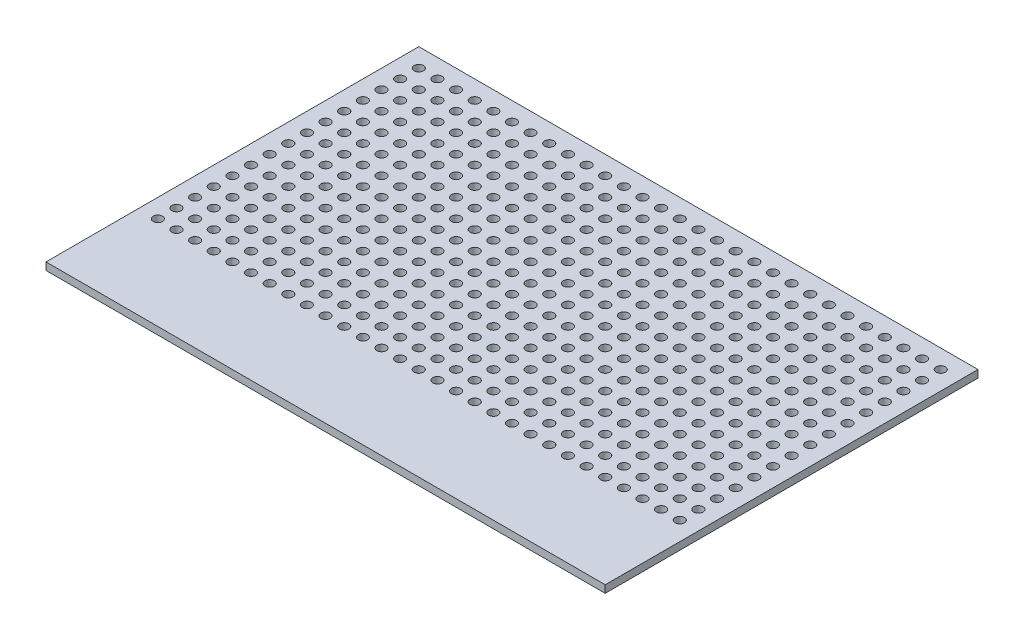
from build123d import *

# Parameters (mm, degrees)
SKETCH1_W           = 600
SKETCH1_H           = 400
BOSS_EXTRUDE1_DEPTH = 8
SKETCH2_R           = 5
CUT_EXTRUDE1_DEPTH  = 8
LPATTERN1_OUTLINE_R = 5
LPATTERN1_DEPTH     = 8


# Read off the part's stored shape, not the designer's step: LPattern1
with BuildPart() as part:
    # Sketch1 → Boss-Extrude1 (new body)
    with BuildSketch(Plane(origin=(0, 0, 0), x_dir=(1, 0, 0), z_dir=(0, 1, 0))):
        Rectangle(SKETCH1_W, SKETCH1_H)
    extrude(amount=BOSS_EXTRUDE1_DEPTH)

    # Sketch2 → Cut-Extrude1 (cut)
    with BuildSketch(Plane(origin=(0, 8, 0), x_dir=(1, 0, 0), z_dir=(0, 1, 0))):
        with Locations(Location((-280, 180, 0), (0, 0, 270))):
            Circle(SKETCH2_R)
    extrude(amount=-CUT_EXTRUDE1_DEPTH, mode=Mode.SUBTRACT)

    # LPattern1 outline → LPattern1 (cut)
    with BuildSketch(Plane(origin=(0, 0, 0), x_dir=(1, 0, 0), z_dir=(0, 1, 0))):
        with Locations((280, -100)):
            Circle(LPATTERN1_OUTLINE_R)
        with Locations((260, -100)):
            Circle(LPATTERN1_OUTLINE_R)
        with Locations((240, -100)):
            Circle(LPATTERN1_OUTLINE_R)
        with Locations((220, -100)):
            Circle(LPATTERN1_OUTLINE_R)
        with Locations((200, -100)):
            Circle(LPATTERN1_OUTLINE_R)
        with Locations((180, -100)):
            Circle(LPATTERN1_OUTLINE_R)
        with Locations((160, -100)):
            Circle(LPATTERN1_OUTLINE_R)
        with Locations((140, -100)):
            Circle(LPATTERN1_OUTLINE_R)
        with Locations((120, -100)):
            Circle(LPATTERN1_OUTLINE_R)
        with Locations((100, -100)):
            Circle(LPATTERN1_OUTLINE_R)
        with Locations((80, -100)):
            Circle(LPATTERN1_OUTLINE_R)
        with Locations((60, -100)):
            Circle(LPATTERN1_OUTLINE_R)
        with Locations((40, -100)):
            Circle(LPATTERN1_OUTLINE_R)
        with Locations((20, -100)):
            Circle(LPATTERN1_OUTLINE_R)
        with Locations((0, -100)):
            Circle(LPATTERN1_OUTLINE_R)
        with Locations((-20, -100)):
            Circle(LPATTERN1_OUTLINE_R)
        with Locations((-40, -100)):
            Circle(LPATTERN1_OUTLINE_R)
        with Locations((-60, -100)):
            Circle(LPATTERN1_OUTLINE_R)
        with Locations((-80, -100)):
            Circle(LPATTERN1_OUTLINE_R)
        with Locations((-100, -100)):
            Circle(LPATTERN1_OUTLINE_R)
        with Locations((-120, -100)):
            Circle(LPATTERN1_OUTLINE_R)
        with Locations((-140, -100)):
            Circle(LPATTERN1_OUTLINE_R)
        with Locations((-160, -100)):
            Circle(LPATTERN1_OUTLINE_R)
        with Locations((-180, -100)):
            Circle(LPATTERN1_OUTLINE_R)
        with Locations((-200, -100)):
            Circle(LPATTERN1_OUTLINE_R)
        with Locations((-220, -100)):
            Circle(LPATTERN1_OUTLINE_R)
        with Locations((-240, -100)):
            Circle(LPATTERN1_OUTLINE_R)
        with Locations((-260, -100)):
            Circle(LPATTERN1_OUTLINE_R)
        with Locations((-280, -100)):
            Circle(LPATTERN1_OUTLINE_R)
        with Locations((280, -80)):
            Circle(LPATTERN1_OUTLINE_R)
        with Locations((260, -80)):
            Circle(LPATTERN1_OUTLINE_R)
        with Locations((240, -80)):
            Circle(LPATTERN1_OUTLINE_R)
        with Locations((220, -80)):
            Circle(LPATTERN1_OUTLINE_R)
        with Locations((200, -80)):
            Circle(LPATTERN1_OUTLINE_R)
        with Locations((180, -80)):
            Circle(LPATTERN1_OUTLINE_R)
        with Locations((160, -80)):
            Circle(LPATTERN1_OUTLINE_R)
        with Locations((140, -80)):
            Circle(LPATTERN1_OUTLINE_R)
        with Locations((120, -80)):
            Circle(LPATTERN1_OUTLINE_R)
        with Locations((100, -80)):
            Circle(LPATTERN1_OUTLINE_R)
        with Locations((80, -80)):
            Circle(LPATTERN1_OUTLINE_R)
        with Locations((60, -80)):
            Circle(LPATTERN1_OUTLINE_R)
        with Locations((40, -80)):
            Circle(LPATTERN1_OUTLINE_R)
        with Locations((20, -80)):
            Circle(LPATTERN1_OUTLINE_R)
        with Locations((0, -80)):
            Circle(LPATTERN1_OUTLINE_R)
        with Locations((-20, -80)):
            Circle(LPATTERN1_OUTLINE_R)
        with Locations((-40, -80)):
            Circle(LPATTERN1_OUTLINE_R)
        with Locations((-60, -80)):
            Circle(LPATTERN1_OUTLINE_R)
        with Locations((-80, -80)):
            Circle(LPATTERN1_OUTLINE_R)
        with Locations((-100, -80)):
            Circle(LPATTERN1_OUTLINE_R)
        with Locations((-120, -80)):
            Circle(LPATTERN1_OUTLINE_R)
        with Locations((-140, -80)):
            Circle(LPATTERN1_OUTLINE_R)
        with Locations((-160, -80)):
            Circle(LPATTERN1_OUTLINE_R)
        with Locations((-180, -80)):
            Circle(LPATTERN1_OUTLINE_R)
        with Locations((-200, -80)):
            Circle(LPATTERN1_OUTLINE_R)
        with Locations((-220, -80)):
            Circle(LPATTERN1_OUTLINE_R)
        with Locations((-240, -80)):
            Circle(LPATTERN1_OUTLINE_R)
        with Locations((-260, -80)):
            Circle(LPATTERN1_OUTLINE_R)
        with Locations((-280, -80)):
            Circle(LPATTERN1_OUTLINE_R)
        with Locations((280, -60)):
            Circle(LPATTERN1_OUTLINE_R)
        with Locations((260, -60)):
            Circle(LPATTERN1_OUTLINE_R)
        with Locations((240, -60)):
            Circle(LPATTERN1_OUTLINE_R)
        with Locations((220, -60)):
            Circle(LPATTERN1_OUTLINE_R)
        with Locations((200, -60)):
            Circle(LPATTERN1_OUTLINE_R)
        with Locations((180, -60)):
            Circle(LPATTERN1_OUTLINE_R)
        with Locations((160, -60)):
            Circle(LPATTERN1_OUTLINE_R)
        with Locations((140, -60)):
            Circle(LPATTERN1_OUTLINE_R)
        with Locations((120, -60)):
            Circle(LPATTERN1_OUTLINE_R)
        with Locations((100, -60)):
            Circle(LPATTERN1_OUTLINE_R)
        with Locations((80, -60)):
            Circle(LPATTERN1_OUTLINE_R)
        with Locations((60, -60)):
            Circle(LPATTERN1_OUTLINE_R)
        with Locations((40, -60)):
            Circle(LPATTERN1_OUTLINE_R)
        with Locations((20, -60)):
            Circle(LPATTERN1_OUTLINE_R)
        with Locations((0, -60)):
            Circle(LPATTERN1_OUTLINE_R)
        with Locations((-20, -60)):
            Circle(LPATTERN1_OUTLINE_R)
        with Locations((-40, -60)):
            Circle(LPATTERN1_OUTLINE_R)
        with Locations((-60, -60)):
            Circle(LPATTERN1_OUTLINE_R)
        with Locations((-80, -60)):
            Circle(LPATTERN1_OUTLINE_R)
        with Locations((-100, -60)):
            Circle(LPATTERN1_OUTLINE_R)
        with Locations((-120, -60)):
            Circle(LPATTERN1_OUTLINE_R)
        with Locations((-140, -60)):
            Circle(LPATTERN1_OUTLINE_R)
        with Locations((-160, -60)):
            Circle(LPATTERN1_OUTLINE_R)
        with Locations((-180, -60)):
            Circle(LPATTERN1_OUTLINE_R)
        with Locations((-200, -60)):
            Circle(LPATTERN1_OUTLINE_R)
        with Locations((-220, -60)):
            Circle(LPATTERN1_OUTLINE_R)
        with Locations((-240, -60)):
            Circle(LPATTERN1_OUTLINE_R)
        with Locations((-260, -60)):
            Circle(LPATTERN1_OUTLINE_R)
        with Locations((-280, -60)):
            Circle(LPATTERN1_OUTLINE_R)
        with Locations((280, -40)):
            Circle(LPATTERN1_OUTLINE_R)
        with Locations((260, -40)):
            Circle(LPATTERN1_OUTLINE_R)
        with Locations((240, -40)):
            Circle(LPATTERN1_OUTLINE_R)
        with Locations((220, -40)):
            Circle(LPATTERN1_OUTLINE_R)
        with Locations((200, -40)):
            Circle(LPATTERN1_OUTLINE_R)
        with Locations((180, -40)):
            Circle(LPATTERN1_OUTLINE_R)
        with Locations((160, -40)):
            Circle(LPATTERN1_OUTLINE_R)
        with Locations((140, -40)):
            Circle(LPATTERN1_OUTLINE_R)
        with Locations((120, -40)):
            Circle(LPATTERN1_OUTLINE_R)
        with Locations((100, -40)):
            Circle(LPATTERN1_OUTLINE_R)
        with Locations((80, -40)):
            Circle(LPATTERN1_OUTLINE_R)
        with Locations((60, -40)):
            Circle(LPATTERN1_OUTLINE_R)
        with Locations((40, -40)):
            Circle(LPATTERN1_OUTLINE_R)
        with Locations((20, -40)):
            Circle(LPATTERN1_OUTLINE_R)
        with Locations((0, -40)):
            Circle(LPATTERN1_OUTLINE_R)
        with Locations((-20, -40)):
            Circle(LPATTERN1_OUTLINE_R)
        with Locations((-40, -40)):
            Circle(LPATTERN1_OUTLINE_R)
        with Locations((-60, -40)):
            Circle(LPATTERN1_OUTLINE_R)
        with Locations((-80, -40)):
            Circle(LPATTERN1_OUTLINE_R)
        with Locations((-100, -40)):
            Circle(LPATTERN1_OUTLINE_R)
        with Locations((-120, -40)):
            Circle(LPATTERN1_OUTLINE_R)
        with Locations((-140, -40)):
            Circle(LPATTERN1_OUTLINE_R)
        with Locations((-160, -40)):
            Circle(LPATTERN1_OUTLINE_R)
        with Locations((-180, -40)):
            Circle(LPATTERN1_OUTLINE_R)
        with Locations((-200, -40)):
            Circle(LPATTERN1_OUTLINE_R)
        with Locations((-220, -40)):
            Circle(LPATTERN1_OUTLINE_R)
        with Locations((-240, -40)):
            Circle(LPATTERN1_OUTLINE_R)
        with Locations((-260, -40)):
            Circle(LPATTERN1_OUTLINE_R)
        with Locations((-280, -40)):
            Circle(LPATTERN1_OUTLINE_R)
        with Locations((280, -20)):
            Circle(LPATTERN1_OUTLINE_R)
        with Locations((260, -20)):
            Circle(LPATTERN1_OUTLINE_R)
        with Locations((240, -20)):
            Circle(LPATTERN1_OUTLINE_R)
        with Locations((220, -20)):
            Circle(LPATTERN1_OUTLINE_R)
        with Locations((200, -20)):
            Circle(LPATTERN1_OUTLINE_R)
        with Locations((180, -20)):
            Circle(LPATTERN1_OUTLINE_R)
        with Locations((160, -20)):
            Circle(LPATTERN1_OUTLINE_R)
        with Locations((140, -20)):
            Circle(LPATTERN1_OUTLINE_R)
        with Locations((120, -20)):
            Circle(LPATTERN1_OUTLINE_R)
        with Locations((100, -20)):
            Circle(LPATTERN1_OUTLINE_R)
        with Locations((80, -20)):
            Circle(LPATTERN1_OUTLINE_R)
        with Locations((60, -20)):
            Circle(LPATTERN1_OUTLINE_R)
        with Locations((40, -20)):
            Circle(LPATTERN1_OUTLINE_R)
        with Locations((20, -20)):
            Circle(LPATTERN1_OUTLINE_R)
        with Locations((0, -20)):
            Circle(LPATTERN1_OUTLINE_R)
        with Locations((-20, -20)):
            Circle(LPATTERN1_OUTLINE_R)
        with Locations((-40, -20)):
            Circle(LPATTERN1_OUTLINE_R)
        with Locations((-60, -20)):
            Circle(LPATTERN1_OUTLINE_R)
        with Locations((-80, -20)):
            Circle(LPATTERN1_OUTLINE_R)
        with Locations((-100, -20)):
            Circle(LPATTERN1_OUTLINE_R)
        with Locations((-120, -20)):
            Circle(LPATTERN1_OUTLINE_R)
        with Locations((-140, -20)):
            Circle(LPATTERN1_OUTLINE_R)
        with Locations((-160, -20)):
            Circle(LPATTERN1_OUTLINE_R)
        with Locations((-180, -20)):
            Circle(LPATTERN1_OUTLINE_R)
        with Locations((-200, -20)):
            Circle(LPATTERN1_OUTLINE_R)
        with Locations((-220, -20)):
            Circle(LPATTERN1_OUTLINE_R)
        with Locations((-240, -20)):
            Circle(LPATTERN1_OUTLINE_R)
        with Locations((-260, -20)):
            Circle(LPATTERN1_OUTLINE_R)
        with Locations((-280, -20)):
            Circle(LPATTERN1_OUTLINE_R)
        with Locations((280, 0)):
            Circle(LPATTERN1_OUTLINE_R)
        with Locations((260, 0)):
            Circle(LPATTERN1_OUTLINE_R)
        with Locations((240, 0)):
            Circle(LPATTERN1_OUTLINE_R)
        with Locations((220, 0)):
            Circle(LPATTERN1_OUTLINE_R)
        with Locations((200, 0)):
            Circle(LPATTERN1_OUTLINE_R)
        with Locations((180, 0)):
            Circle(LPATTERN1_OUTLINE_R)
        with Locations((160, 0)):
            Circle(LPATTERN1_OUTLINE_R)
        with Locations((140, 0)):
            Circle(LPATTERN1_OUTLINE_R)
        with Locations((120, 0)):
            Circle(LPATTERN1_OUTLINE_R)
        with Locations((100, 0)):
            Circle(LPATTERN1_OUTLINE_R)
        with Locations((80, 0)):
            Circle(LPATTERN1_OUTLINE_R)
        with Locations((60, 0)):
            Circle(LPATTERN1_OUTLINE_R)
        with Locations((40, 0)):
            Circle(LPATTERN1_OUTLINE_R)
        with Locations((20, 0)):
            Circle(LPATTERN1_OUTLINE_R)
        Circle(LPATTERN1_OUTLINE_R)
        with Locations((-20, 0)):
            Circle(LPATTERN1_OUTLINE_R)
        with Locations((-40, 0)):
            Circle(LPATTERN1_OUTLINE_R)
        with Locations((-60, 0)):
            Circle(LPATTERN1_OUTLINE_R)
        with Locations((-80, 0)):
            Circle(LPATTERN1_OUTLINE_R)
        with Locations((-100, 0)):
            Circle(LPATTERN1_OUTLINE_R)
        with Locations((-120, 0)):
            Circle(LPATTERN1_OUTLINE_R)
        with Locations((-140, 0)):
            Circle(LPATTERN1_OUTLINE_R)
        with Locations((-160, 0)):
            Circle(LPATTERN1_OUTLINE_R)
        with Locations((-180, 0)):
            Circle(LPATTERN1_OUTLINE_R)
        with Locations((-200, 0)):
            Circle(LPATTERN1_OUTLINE_R)
        with Locations((-220, 0)):
            Circle(LPATTERN1_OUTLINE_R)
        with Locations((-240, 0)):
            Circle(LPATTERN1_OUTLINE_R)
        with Locations((-260, 0)):
            Circle(LPATTERN1_OUTLINE_R)
        with Locations((-280, 0)):
            Circle(LPATTERN1_OUTLINE_R)
        with Locations((280, 20)):
            Circle(LPATTERN1_OUTLINE_R)
        with Locations((260, 20)):
            Circle(LPATTERN1_OUTLINE_R)
        with Locations((240, 20)):
            Circle(LPATTERN1_OUTLINE_R)
        with Locations((220, 20)):
            Circle(LPATTERN1_OUTLINE_R)
        with Locations((200, 20)):
            Circle(LPATTERN1_OUTLINE_R)
        with Locations((180, 20)):
            Circle(LPATTERN1_OUTLINE_R)
        with Locations((160, 20)):
            Circle(LPATTERN1_OUTLINE_R)
        with Locations((140, 20)):
            Circle(LPATTERN1_OUTLINE_R)
        with Locations((120, 20)):
            Circle(LPATTERN1_OUTLINE_R)
        with Locations((100, 20)):
            Circle(LPATTERN1_OUTLINE_R)
        with Locations((80, 20)):
            Circle(LPATTERN1_OUTLINE_R)
        with Locations((60, 20)):
            Circle(LPATTERN1_OUTLINE_R)
        with Locations((40, 20)):
            Circle(LPATTERN1_OUTLINE_R)
        with Locations((20, 20)):
            Circle(LPATTERN1_OUTLINE_R)
        with Locations((0, 20)):
            Circle(LPATTERN1_OUTLINE_R)
        with Locations((-20, 20)):
            Circle(LPATTERN1_OUTLINE_R)
        with Locations((-40, 20)):
            Circle(LPATTERN1_OUTLINE_R)
        with Locations((-60, 20)):
            Circle(LPATTERN1_OUTLINE_R)
        with Locations((-80, 20)):
            Circle(LPATTERN1_OUTLINE_R)
        with Locations((-100, 20)):
            Circle(LPATTERN1_OUTLINE_R)
        with Locations((-120, 20)):
            Circle(LPATTERN1_OUTLINE_R)
        with Locations((-140, 20)):
            Circle(LPATTERN1_OUTLINE_R)
        with Locations((-160, 20)):
            Circle(LPATTERN1_OUTLINE_R)
        with Locations((-180, 20)):
            Circle(LPATTERN1_OUTLINE_R)
        with Locations((-200, 20)):
            Circle(LPATTERN1_OUTLINE_R)
        with Locations((-220, 20)):
            Circle(LPATTERN1_OUTLINE_R)
        with Locations((-240, 20)):
            Circle(LPATTERN1_OUTLINE_R)
        with Locations((-260, 20)):
            Circle(LPATTERN1_OUTLINE_R)
        with Locations((-280, 20)):
            Circle(LPATTERN1_OUTLINE_R)
        with Locations((280, 40)):
            Circle(LPATTERN1_OUTLINE_R)
        with Locations((260, 40)):
            Circle(LPATTERN1_OUTLINE_R)
        with Locations((240, 40)):
            Circle(LPATTERN1_OUTLINE_R)
        with Locations((220, 40)):
            Circle(LPATTERN1_OUTLINE_R)
        with Locations((200, 40)):
            Circle(LPATTERN1_OUTLINE_R)
        with Locations((180, 40)):
            Circle(LPATTERN1_OUTLINE_R)
        with Locations((160, 40)):
            Circle(LPATTERN1_OUTLINE_R)
        with Locations((140, 40)):
            Circle(LPATTERN1_OUTLINE_R)
        with Locations((120, 40)):
            Circle(LPATTERN1_OUTLINE_R)
        with Locations((100, 40)):
            Circle(LPATTERN1_OUTLINE_R)
        with Locations((80, 40)):
            Circle(LPATTERN1_OUTLINE_R)
        with Locations((60, 40)):
            Circle(LPATTERN1_OUTLINE_R)
        with Locations((40, 40)):
            Circle(LPATTERN1_OUTLINE_R)
        with Locations((20, 40)):
            Circle(LPATTERN1_OUTLINE_R)
        with Locations((0, 40)):
            Circle(LPATTERN1_OUTLINE_R)
        with Locations((-20, 40)):
            Circle(LPATTERN1_OUTLINE_R)
        with Locations((-40, 40)):
            Circle(LPATTERN1_OUTLINE_R)
        with Locations((-60, 40)):
            Circle(LPATTERN1_OUTLINE_R)
        with Locations((-80, 40)):
            Circle(LPATTERN1_OUTLINE_R)
        with Locations((-100, 40)):
            Circle(LPATTERN1_OUTLINE_R)
        with Locations((-120, 40)):
            Circle(LPATTERN1_OUTLINE_R)
        with Locations((-140, 40)):
            Circle(LPATTERN1_OUTLINE_R)
        with Locations((-160, 40)):
            Circle(LPATTERN1_OUTLINE_R)
        with Locations((-180, 40)):
            Circle(LPATTERN1_OUTLINE_R)
        with Locations((-200, 40)):
            Circle(LPATTERN1_OUTLINE_R)
        with Locations((-220, 40)):
            Circle(LPATTERN1_OUTLINE_R)
        with Locations((-240, 40)):
            Circle(LPATTERN1_OUTLINE_R)
        with Locations((-260, 40)):
            Circle(LPATTERN1_OUTLINE_R)
        with Locations((-280, 40)):
            Circle(LPATTERN1_OUTLINE_R)
        with Locations((280, 60)):
            Circle(LPATTERN1_OUTLINE_R)
        with Locations((260, 60)):
            Circle(LPATTERN1_OUTLINE_R)
        with Locations((240, 60)):
            Circle(LPATTERN1_OUTLINE_R)
        with Locations((220, 60)):
            Circle(LPATTERN1_OUTLINE_R)
        with Locations((200, 60)):
            Circle(LPATTERN1_OUTLINE_R)
        with Locations((180, 60)):
            Circle(LPATTERN1_OUTLINE_R)
        with Locations((160, 60)):
            Circle(LPATTERN1_OUTLINE_R)
        with Locations((140, 60)):
            Circle(LPATTERN1_OUTLINE_R)
        with Locations((120, 60)):
            Circle(LPATTERN1_OUTLINE_R)
        with Locations((100, 60)):
            Circle(LPATTERN1_OUTLINE_R)
        with Locations((80, 60)):
            Circle(LPATTERN1_OUTLINE_R)
        with Locations((60, 60)):
            Circle(LPATTERN1_OUTLINE_R)
        with Locations((40, 60)):
            Circle(LPATTERN1_OUTLINE_R)
        with Locations((20, 60)):
            Circle(LPATTERN1_OUTLINE_R)
        with Locations((0, 60)):
            Circle(LPATTERN1_OUTLINE_R)
        with Locations((-20, 60)):
            Circle(LPATTERN1_OUTLINE_R)
        with Locations((-40, 60)):
            Circle(LPATTERN1_OUTLINE_R)
        with Locations((-60, 60)):
            Circle(LPATTERN1_OUTLINE_R)
        with Locations((-80, 60)):
            Circle(LPATTERN1_OUTLINE_R)
        with Locations((-100, 60)):
            Circle(LPATTERN1_OUTLINE_R)
        with Locations((-120, 60)):
            Circle(LPATTERN1_OUTLINE_R)
        with Locations((-140, 60)):
            Circle(LPATTERN1_OUTLINE_R)
        with Locations((-160, 60)):
            Circle(LPATTERN1_OUTLINE_R)
        with Locations((-180, 60)):
            Circle(LPATTERN1_OUTLINE_R)
        with Locations((-200, 60)):
            Circle(LPATTERN1_OUTLINE_R)
        with Locations((-220, 60)):
            Circle(LPATTERN1_OUTLINE_R)
        with Locations((-240, 60)):
            Circle(LPATTERN1_OUTLINE_R)
        with Locations((-260, 60)):
            Circle(LPATTERN1_OUTLINE_R)
        with Locations((-280, 60)):
            Circle(LPATTERN1_OUTLINE_R)
        with Locations((280, 80)):
            Circle(LPATTERN1_OUTLINE_R)
        with Locations((260, 80)):
            Circle(LPATTERN1_OUTLINE_R)
        with Locations((240, 80)):
            Circle(LPATTERN1_OUTLINE_R)
        with Locations((220, 80)):
            Circle(LPATTERN1_OUTLINE_R)
        with Locations((200, 80)):
            Circle(LPATTERN1_OUTLINE_R)
        with Locations((180, 80)):
            Circle(LPATTERN1_OUTLINE_R)
        with Locations((160, 80)):
            Circle(LPATTERN1_OUTLINE_R)
        with Locations((140, 80)):
            Circle(LPATTERN1_OUTLINE_R)
        with Locations((120, 80)):
            Circle(LPATTERN1_OUTLINE_R)
        with Locations((100, 80)):
            Circle(LPATTERN1_OUTLINE_R)
        with Locations((80, 80)):
            Circle(LPATTERN1_OUTLINE_R)
        with Locations((60, 80)):
            Circle(LPATTERN1_OUTLINE_R)
        with Locations((40, 80)):
            Circle(LPATTERN1_OUTLINE_R)
        with Locations((20, 80)):
            Circle(LPATTERN1_OUTLINE_R)
        with Locations((0, 80)):
            Circle(LPATTERN1_OUTLINE_R)
        with Locations((-20, 80)):
            Circle(LPATTERN1_OUTLINE_R)
        with Locations((-40, 80)):
            Circle(LPATTERN1_OUTLINE_R)
        with Locations((-60, 80)):
            Circle(LPATTERN1_OUTLINE_R)
        with Locations((-80, 80)):
            Circle(LPATTERN1_OUTLINE_R)
        with Locations((-100, 80)):
            Circle(LPATTERN1_OUTLINE_R)
        with Locations((-120, 80)):
            Circle(LPATTERN1_OUTLINE_R)
        with Locations((-140, 80)):
            Circle(LPATTERN1_OUTLINE_R)
        with Locations((-160, 80)):
            Circle(LPATTERN1_OUTLINE_R)
        with Locations((-180, 80)):
            Circle(LPATTERN1_OUTLINE_R)
        with Locations((-200, 80)):
            Circle(LPATTERN1_OUTLINE_R)
        with Locations((-220, 80)):
            Circle(LPATTERN1_OUTLINE_R)
        with Locations((-240, 80)):
            Circle(LPATTERN1_OUTLINE_R)
        with Locations((-260, 80)):
            Circle(LPATTERN1_OUTLINE_R)
        with Locations((-280, 80)):
            Circle(LPATTERN1_OUTLINE_R)
        with Locations((280, 100)):
            Circle(LPATTERN1_OUTLINE_R)
        with Locations((260, 100)):
            Circle(LPATTERN1_OUTLINE_R)
        with Locations((240, 100)):
            Circle(LPATTERN1_OUTLINE_R)
        with Locations((220, 100)):
            Circle(LPATTERN1_OUTLINE_R)
        with Locations((200, 100)):
            Circle(LPATTERN1_OUTLINE_R)
        with Locations((180, 100)):
            Circle(LPATTERN1_OUTLINE_R)
        with Locations((160, 100)):
            Circle(LPATTERN1_OUTLINE_R)
        with Locations((140, 100)):
            Circle(LPATTERN1_OUTLINE_R)
        with Locations((120, 100)):
            Circle(LPATTERN1_OUTLINE_R)
        with Locations((100, 100)):
            Circle(LPATTERN1_OUTLINE_R)
        with Locations((80, 100)):
            Circle(LPATTERN1_OUTLINE_R)
        with Locations((60, 100)):
            Circle(LPATTERN1_OUTLINE_R)
        with Locations((40, 100)):
            Circle(LPATTERN1_OUTLINE_R)
        with Locations((20, 100)):
            Circle(LPATTERN1_OUTLINE_R)
        with Locations((0, 100)):
            Circle(LPATTERN1_OUTLINE_R)
        with Locations((-20, 100)):
            Circle(LPATTERN1_OUTLINE_R)
        with Locations((-40, 100)):
            Circle(LPATTERN1_OUTLINE_R)
        with Locations((-60, 100)):
            Circle(LPATTERN1_OUTLINE_R)
        with Locations((-80, 100)):
            Circle(LPATTERN1_OUTLINE_R)
        with Locations((-100, 100)):
            Circle(LPATTERN1_OUTLINE_R)
        with Locations((-120, 100)):
            Circle(LPATTERN1_OUTLINE_R)
        with Locations((-140, 100)):
            Circle(LPATTERN1_OUTLINE_R)
        with Locations((-160, 100)):
            Circle(LPATTERN1_OUTLINE_R)
        with Locations((-180, 100)):
            Circle(LPATTERN1_OUTLINE_R)
        with Locations((-200, 100)):
            Circle(LPATTERN1_OUTLINE_R)
        with Locations((-220, 100)):
            Circle(LPATTERN1_OUTLINE_R)
        with Locations((-240, 100)):
            Circle(LPATTERN1_OUTLINE_R)
        with Locations((-260, 100)):
            Circle(LPATTERN1_OUTLINE_R)
        with Locations((-280, 100)):
            Circle(LPATTERN1_OUTLINE_R)
        with Locations((280, 120)):
            Circle(LPATTERN1_OUTLINE_R)
        with Locations((260, 120)):
            Circle(LPATTERN1_OUTLINE_R)
        with Locations((240, 120)):
            Circle(LPATTERN1_OUTLINE_R)
        with Locations((220, 120)):
            Circle(LPATTERN1_OUTLINE_R)
        with Locations((200, 120)):
            Circle(LPATTERN1_OUTLINE_R)
        with Locations((180, 120)):
            Circle(LPATTERN1_OUTLINE_R)
        with Locations((160, 120)):
            Circle(LPATTERN1_OUTLINE_R)
        with Locations((140, 120)):
            Circle(LPATTERN1_OUTLINE_R)
        with Locations((120, 120)):
            Circle(LPATTERN1_OUTLINE_R)
        with Locations((100, 120)):
            Circle(LPATTERN1_OUTLINE_R)
        with Locations((80, 120)):
            Circle(LPATTERN1_OUTLINE_R)
        with Locations((60, 120)):
            Circle(LPATTERN1_OUTLINE_R)
        with Locations((40, 120)):
            Circle(LPATTERN1_OUTLINE_R)
        with Locations((20, 120)):
            Circle(LPATTERN1_OUTLINE_R)
        with Locations((0, 120)):
            Circle(LPATTERN1_OUTLINE_R)
        with Locations((-20, 120)):
            Circle(LPATTERN1_OUTLINE_R)
        with Locations((-40, 120)):
            Circle(LPATTERN1_OUTLINE_R)
        with Locations((-60, 120)):
            Circle(LPATTERN1_OUTLINE_R)
        with Locations((-80, 120)):
            Circle(LPATTERN1_OUTLINE_R)
        with Locations((-100, 120)):
            Circle(LPATTERN1_OUTLINE_R)
        with Locations((-120, 120)):
            Circle(LPATTERN1_OUTLINE_R)
        with Locations((-140, 120)):
            Circle(LPATTERN1_OUTLINE_R)
        with Locations((-160, 120)):
            Circle(LPATTERN1_OUTLINE_R)
        with Locations((-180, 120)):
            Circle(LPATTERN1_OUTLINE_R)
        with Locations((-200, 120)):
            Circle(LPATTERN1_OUTLINE_R)
        with Locations((-220, 120)):
            Circle(LPATTERN1_OUTLINE_R)
        with Locations((-240, 120)):
            Circle(LPATTERN1_OUTLINE_R)
        with Locations((-260, 120)):
            Circle(LPATTERN1_OUTLINE_R)
        with Locations((-280, 120)):
            Circle(LPATTERN1_OUTLINE_R)
        with Locations((280, 140)):
            Circle(LPATTERN1_OUTLINE_R)
        with Locations((260, 140)):
            Circle(LPATTERN1_OUTLINE_R)
        with Locations((240, 140)):
            Circle(LPATTERN1_OUTLINE_R)
        with Locations((220, 140)):
            Circle(LPATTERN1_OUTLINE_R)
        with Locations((200, 140)):
            Circle(LPATTERN1_OUTLINE_R)
        with Locations((180, 140)):
            Circle(LPATTERN1_OUTLINE_R)
        with Locations((160, 140)):
            Circle(LPATTERN1_OUTLINE_R)
        with Locations((140, 140)):
            Circle(LPATTERN1_OUTLINE_R)
        with Locations((120, 140)):
            Circle(LPATTERN1_OUTLINE_R)
        with Locations((100, 140)):
            Circle(LPATTERN1_OUTLINE_R)
        with Locations((80, 140)):
            Circle(LPATTERN1_OUTLINE_R)
        with Locations((60, 140)):
            Circle(LPATTERN1_OUTLINE_R)
        with Locations((40, 140)):
            Circle(LPATTERN1_OUTLINE_R)
        with Locations((20, 140)):
            Circle(LPATTERN1_OUTLINE_R)
        with Locations((0, 140)):
            Circle(LPATTERN1_OUTLINE_R)
        with Locations((-20, 140)):
            Circle(LPATTERN1_OUTLINE_R)
        with Locations((-40, 140)):
            Circle(LPATTERN1_OUTLINE_R)
        with Locations((-60, 140)):
            Circle(LPATTERN1_OUTLINE_R)
        with Locations((-80, 140)):
            Circle(LPATTERN1_OUTLINE_R)
        with Locations((-100, 140)):
            Circle(LPATTERN1_OUTLINE_R)
        with Locations((-120, 140)):
            Circle(LPATTERN1_OUTLINE_R)
        with Locations((-140, 140)):
            Circle(LPATTERN1_OUTLINE_R)
        with Locations((-160, 140)):
            Circle(LPATTERN1_OUTLINE_R)
        with Locations((-180, 140)):
            Circle(LPATTERN1_OUTLINE_R)
        with Locations((-200, 140)):
            Circle(LPATTERN1_OUTLINE_R)
        with Locations((-220, 140)):
            Circle(LPATTERN1_OUTLINE_R)
        with Locations((-240, 140)):
            Circle(LPATTERN1_OUTLINE_R)
        with Locations((-260, 140)):
            Circle(LPATTERN1_OUTLINE_R)
        with Locations((-280, 140)):
            Circle(LPATTERN1_OUTLINE_R)
        with Locations((280, 160)):
            Circle(LPATTERN1_OUTLINE_R)
        with Locations((260, 160)):
            Circle(LPATTERN1_OUTLINE_R)
        with Locations((240, 160)):
            Circle(LPATTERN1_OUTLINE_R)
        with Locations((220, 160)):
            Circle(LPATTERN1_OUTLINE_R)
        with Locations((200, 160)):
            Circle(LPATTERN1_OUTLINE_R)
        with Locations((180, 160)):
            Circle(LPATTERN1_OUTLINE_R)
        with Locations((160, 160)):
            Circle(LPATTERN1_OUTLINE_R)
        with Locations((140, 160)):
            Circle(LPATTERN1_OUTLINE_R)
        with Locations((120, 160)):
            Circle(LPATTERN1_OUTLINE_R)
        with Locations((100, 160)):
            Circle(LPATTERN1_OUTLINE_R)
        with Locations((80, 160)):
            Circle(LPATTERN1_OUTLINE_R)
        with Locations((60, 160)):
            Circle(LPATTERN1_OUTLINE_R)
        with Locations((40, 160)):
            Circle(LPATTERN1_OUTLINE_R)
        with Locations((20, 160)):
            Circle(LPATTERN1_OUTLINE_R)
        with Locations((0, 160)):
            Circle(LPATTERN1_OUTLINE_R)
        with Locations((-20, 160)):
            Circle(LPATTERN1_OUTLINE_R)
        with Locations((-40, 160)):
            Circle(LPATTERN1_OUTLINE_R)
        with Locations((-60, 160)):
            Circle(LPATTERN1_OUTLINE_R)
        with Locations((-80, 160)):
            Circle(LPATTERN1_OUTLINE_R)
        with Locations((-100, 160)):
            Circle(LPATTERN1_OUTLINE_R)
        with Locations((-120, 160)):
            Circle(LPATTERN1_OUTLINE_R)
        with Locations((-140, 160)):
            Circle(LPATTERN1_OUTLINE_R)
        with Locations((-160, 160)):
            Circle(LPATTERN1_OUTLINE_R)
        with Locations((-180, 160)):
            Circle(LPATTERN1_OUTLINE_R)
        with Locations((-200, 160)):
            Circle(LPATTERN1_OUTLINE_R)
        with Locations((-220, 160)):
            Circle(LPATTERN1_OUTLINE_R)
        with Locations((-240, 160)):
            Circle(LPATTERN1_OUTLINE_R)
        with Locations((-260, 160)):
            Circle(LPATTERN1_OUTLINE_R)
        with Locations((-280, 160)):
            Circle(LPATTERN1_OUTLINE_R)
        with Locations((280, 180)):
            Circle(LPATTERN1_OUTLINE_R)
        with Locations((260, 180)):
            Circle(LPATTERN1_OUTLINE_R)
        with Locations((240, 180)):
            Circle(LPATTERN1_OUTLINE_R)
        with Locations((220, 180)):
            Circle(LPATTERN1_OUTLINE_R)
        with Locations((200, 180)):
            Circle(LPATTERN1_OUTLINE_R)
        with Locations((180, 180)):
            Circle(LPATTERN1_OUTLINE_R)
        with Locations((160, 180)):
            Circle(LPATTERN1_OUTLINE_R)
        with Locations((140, 180)):
            Circle(LPATTERN1_OUTLINE_R)
        with Locations((120, 180)):
            Circle(LPATTERN1_OUTLINE_R)
        with Locations((100, 180)):
            Circle(LPATTERN1_OUTLINE_R)
        with Locations((80, 180)):
            Circle(LPATTERN1_OUTLINE_R)
        with Locations((60, 180)):
            Circle(LPATTERN1_OUTLINE_R)
        with Locations((40, 180)):
            Circle(LPATTERN1_OUTLINE_R)
        with Locations((20, 180)):
            Circle(LPATTERN1_OUTLINE_R)
        with Locations((0, 180)):
            Circle(LPATTERN1_OUTLINE_R)
        with Locations((-20, 180)):
            Circle(LPATTERN1_OUTLINE_R)
        with Locations((-40, 180)):
            Circle(LPATTERN1_OUTLINE_R)
        with Locations((-60, 180)):
            Circle(LPATTERN1_OUTLINE_R)
        with Locations((-80, 180)):
            Circle(LPATTERN1_OUTLINE_R)
        with Locations((-100, 180)):
            Circle(LPATTERN1_OUTLINE_R)
        with Locations((-120, 180)):
            Circle(LPATTERN1_OUTLINE_R)
        with Locations((-140, 180)):
            Circle(LPATTERN1_OUTLINE_R)
        with Locations((-160, 180)):
            Circle(LPATTERN1_OUTLINE_R)
        with Locations((-180, 180)):
            Circle(LPATTERN1_OUTLINE_R)
        with Locations((-200, 180)):
            Circle(LPATTERN1_OUTLINE_R)
        with Locations((-220, 180)):
            Circle(LPATTERN1_OUTLINE_R)
        with Locations((-240, 180)):
            Circle(LPATTERN1_OUTLINE_R)
        with Locations((-260, 180)):
            Circle(LPATTERN1_OUTLINE_R)
    extrude(amount=LPATTERN1_DEPTH, mode=Mode.SUBTRACT)


solid = part.part
